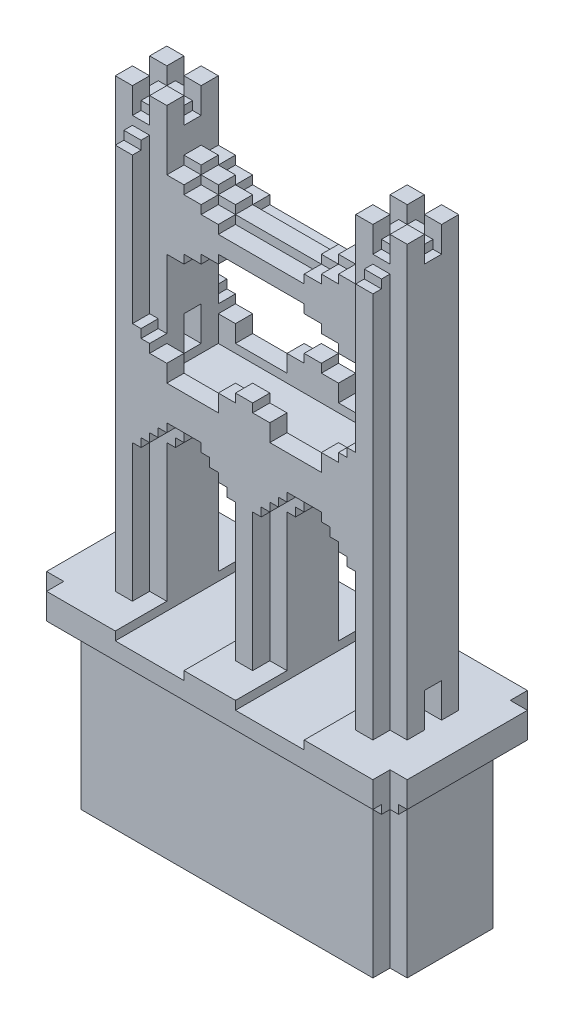
from build123d import *

# Parameters (mm, degrees)
AUFSATZ_LINEAR_AUSTRAGEN1_DEPTH     = 1.5
AUFSATZ_LINEAR_START                = -2.5
AUFSATZ_LINEAR_AUSTRAGEN2_DEPTH     = 5
AUFSATZ_LINEAR_AUSTRAGEN3_DEPTH     = 12
SKIZZE3_W                           = 1
SKIZZE3_H                           = 1
SCHNITT_LINEAR_AUSTRAGEN1_DEPTH     = 15.91643389
SKIZZE6_W                           = 1
SKIZZE6_H                           = 1
AUFSATZ_LINEAR_AUSTRAGEN6_DEPTH     = 12
SKIZZE20_W                          = 5.5
SKIZZE20_H                          = 3
SCHNITT_LINEAR_AUSTRAGEN9_DEPTH     = 0.5
SCHNITT_LINEAR_AUSTRAGEN4_REACH     = 26.749
SKIZZE7_W                           = 1
SKIZZE7_H                           = 2
SKIZZE9_W                           = 2.5
SKIZZE9_H                           = 0.5
SKIZZE9_W_2                         = 1
AUFSATZ_LINEAR_AUSTRAGEN7_DEPTH     = 0.5
AUFSATZ_LINEAR_START_2              = -1.5
AUFSATZ_LINEAR_AUSTRAGEN8_DEPTH     = 3
AUFSATZ_LINEAR_AUSTRAGEN4_OUTLINE_W = 1
AUFSATZ_LINEAR_AUSTRAGEN4_OUTLINE_H = 1
AUFSATZ_LINEAR_AUSTRAGEN4_DEPTH     = 1
AUFSATZ_LINEAR_START_3              = 1
AUFSATZ_LINEAR_AUSTRAGEN5_DEPTH     = 10
AUFSATZ_LINEAR_AUSTRAGEN9_DEPTH     = 1
SCHNITT_LINEAR_AUSTRAGEN5_REACH     = 27.855
SKIZZE8_W                           = 1
SKIZZE8_H                           = 2
SKIZZE16_W                          = 0.5
SKIZZE16_H                          = 0.5
SCHNITT_LINEAR_AUSTRAGEN7_DEPTH     = 1
SKIZZE14_W                          = 1
SKIZZE14_H                          = 1
AUFSATZ_LINEAR_AUSTRAGEN15_DEPTH    = 1
SKIZZE17_W                          = 4
SKIZZE17_H                          = 0.5
SCHNITT_LINEAR_AUSTRAGEN8_DEPTH     = 29.570089254
AUFSATZ_LINEAR_AUSTRAGEN16_REACH    = 29.486
AUFSATZ_LINEAR_AUSTRAGEN17_DEPTH    = 7
SKIZZE21_W                          = 0.5
SKIZZE21_H                          = 1
SCHNITT_LINEAR_AUSTRAGEN10_DEPTH    = 0.5
SCHNITT_LINEAR_AUSTRAGEN11_DEPTH    = 1


# Read off the part's stored shape, not the designer's step: Aufsatz-Linear austragen2, Aufsatz-Linear austragen4, Aufsatz-Linear austragen5
with BuildPart() as part:
    # Skizze1 → Aufsatz-Linear austragen1 (new, symmetric)
    with BuildSketch(Plane.XY):
        Polygon((-3, 9), (-2.5, 9), (-2.5, 8.5), (-2, 8.5), (-2, 8), (-1.5, 8), (-1.5, 0), (0, 0), (0, 12), (-3.5, 12), (-3.5, 9.5), (-3, 9.5), align=None)
    extrude(amount=AUFSATZ_LINEAR_AUSTRAGEN1_DEPTH, both=True)

    # Aufsatz-Linear austragen2 outline → Aufsatz-Linear austragen2 (add)
    with BuildSketch(Plane.XY.offset(AUFSATZ_LINEAR_START)):
        Polygon((-1, 8.5), (-1, 8), (-0.5, 8), (-0.5, 0), (0, 0), (0, 12), (-3.5, 12), (-3.5, 10), (-2.5, 10), (-2.5, 9.5), (-2, 9.5), (-2, 9), (-1.5, 9), (-1.5, 8.5), align=None)
    extrude(amount=AUFSATZ_LINEAR_AUSTRAGEN2_DEPTH)

    # Spiegeln6: part across face


with BuildPart() as part_1:
    add(part.part)
    add(part.part.mirror(Plane(origin=(-3.5, 10.836956522, 0), x_dir=(0, 0, 1), z_dir=(-1, 0, 0))))

    # Skizze2 → Aufsatz-Linear austragen3 (add)
    with BuildSketch(Plane(origin=(0, 12, 0), x_dir=(1, 0, 0), z_dir=(0, 1, 0))):
        Polygon((-7, 2.5), (-7.5, 2.5), (-7.5, 1.5), (-8.5, 1.5), (-8.5, -1.5), (-7.5, -1.5), (-7.5, -2.5), (-7, -2.5), align=None)
    extrude(amount=-AUFSATZ_LINEAR_AUSTRAGEN3_DEPTH)

    # Skizze3 → Schnitt-Linear austragen1 (cut, through all)
    with BuildSketch(Plane(origin=(0, 12, 0), x_dir=(1, 0, 0), z_dir=(0, 1, 0))):
        with Locations((-7, 0)):
            Rectangle(SKIZZE3_W, SKIZZE3_H)
    extrude(amount=-SCHNITT_LINEAR_AUSTRAGEN1_DEPTH, mode=Mode.SUBTRACT)

    # Skizze6 → Aufsatz-Linear austragen6 (add)
    with BuildSketch(Plane(origin=(0, 12, 0), x_dir=(1, 0, 0), z_dir=(0, 1, 0))):
        Polygon((-7.5, 2.5), (-7.5, 1.5), (-8.5, 1.5), (-8.5, -1.5), (-7.5, -1.5), (-7.5, -2.5), (-6.5, -2.5), (-6.5, -1.5), (-5.5, -1.5), (-5.5, 1.5), (-6.5, 1.5), (-6.5, 2.5), align=None)
        with Locations((-7, 0)):
            Rectangle(SKIZZE6_W, SKIZZE6_H, mode=Mode.SUBTRACT)
    extrude(amount=AUFSATZ_LINEAR_AUSTRAGEN6_DEPTH)

    # Skizze20 → Schnitt-Linear austragen9 (cut)
    with BuildSketch(Plane(origin=(0, 12, 0), x_dir=(1, 0, 0), z_dir=(0, 1, 0))):
        with Locations((-2.75, 0)):
            Rectangle(SKIZZE20_W, SKIZZE20_H)
    extrude(amount=-SCHNITT_LINEAR_AUSTRAGEN9_DEPTH, mode=Mode.SUBTRACT)

    # Skizze7 → Schnitt-Linear austragen4 (cut, up to next)
    with BuildSketch(Plane(origin=(-5.5, 0, 0), x_dir=(0, 0, -1), z_dir=(1, 0, 0)), mode=Mode.PRIVATE) as schnitt_linear_austragen4_sk1:
        with Locations((0, 13)):
            Rectangle(SKIZZE7_W, SKIZZE7_H)
    schnitt_linear_austragen4_tool1 = extrude(schnitt_linear_austragen4_sk1.sketch, amount=-SCHNITT_LINEAR_AUSTRAGEN4_REACH, mode=Mode.PRIVATE) & part_1.part
    add(schnitt_linear_austragen4_tool1.solids().sort_by_distance((-5.5, 13, 0))[0], mode=Mode.SUBTRACT)

    # Skizze9 → Aufsatz-Linear austragen7 (add, symmetric)
    with BuildSketch(Plane.XY):
        with Locations((-1.25, 18.75)):
            Rectangle(SKIZZE9_W, SKIZZE9_H)
        Polygon((-3.5, 18.5), (-2.5, 18.5), (-2.5, 19), (0, 19), (0, 19.5), (-5.5, 19.5), (-5.5, 17.5), (-4.5, 17.5), (-4.5, 18), (-3.5, 18), align=None)
        with Locations((-3, 18.25)):
            Rectangle(SKIZZE9_W_2, SKIZZE9_H)
        with Locations((-4, 17.75)):
            Rectangle(SKIZZE9_W_2, SKIZZE9_H)
        with Locations((-5, 17.25)):
            Rectangle(SKIZZE9_W_2, SKIZZE9_H)
        Polygon((-5.5, 19.5), (0, 19.5), (0, 20), (-2.5, 20), (-2.5, 20.5), (-3.5, 20.5), (-3.5, 21), (-4.5, 21), (-4.5, 21.5), (-5.5, 21.5), align=None)
        with Locations((-5, 21.75)):
            Rectangle(SKIZZE9_W_2, SKIZZE9_H)
        with Locations((-4, 21.25)):
            Rectangle(SKIZZE9_W_2, SKIZZE9_H)
        with Locations((-3, 20.75)):
            Rectangle(SKIZZE9_W_2, SKIZZE9_H)
        with Locations((-1.25, 20.25)):
            Rectangle(SKIZZE9_W, SKIZZE9_H)
    extrude(amount=AUFSATZ_LINEAR_AUSTRAGEN7_DEPTH, both=True)

    # Skizze9<3> → Aufsatz-Linear austragen8 (add)
    with BuildSketch(Plane.XY.offset(AUFSATZ_LINEAR_START_2)):
        Polygon((-3.5, 18.5), (-2.5, 18.5), (-2.5, 19), (0, 19), (0, 19.5), (-5.5, 19.5), (-5.5, 17.5), (-4.5, 17.5), (-4.5, 18), (-3.5, 18), align=None)
        Polygon((-5.5, 19.5), (0, 19.5), (0, 20), (-2.5, 20), (-2.5, 20.5), (-3.5, 20.5), (-3.5, 21), (-4.5, 21), (-4.5, 21.5), (-5.5, 21.5), align=None)
    extrude(amount=AUFSATZ_LINEAR_AUSTRAGEN8_DEPTH)

    # Aufsatz-Linear austragen4 outline → Aufsatz-Linear austragen4 (add)
    with BuildSketch(Plane.XZ):
        Polygon((-9.5, -3.5), (-9.5, -4.5), (0, -4.5), (0, 4.5), (-9.5, 4.5), (-9.5, 3.5), (-10.5, 3.5), (-10.5, -3.5), align=None)
        with Locations((-7, 0)):
            Rectangle(AUFSATZ_LINEAR_AUSTRAGEN4_OUTLINE_W, AUFSATZ_LINEAR_AUSTRAGEN4_OUTLINE_H, mode=Mode.SUBTRACT)
    extrude(amount=AUFSATZ_LINEAR_AUSTRAGEN4_DEPTH)

    # Aufsatz-Linear austragen5 outline → Aufsatz-Linear austragen5 (add)
    with BuildSketch(Plane.XZ.offset(AUFSATZ_LINEAR_START_3)):
        Polygon((0, 2.5), (0, 3.5), (-8.5, 3.5), (-8.5, 2.5), (-9.5, 2.5), (-9.5, -2.5), (-8.5, -2.5), (-8.5, -3.5), (0, -3.5), (0, -2.5), (-6.5, -2.5), (-6.5, -0.5), (-7.5, -0.5), (-7.5, 0.5), (-6.5, 0.5), (-6.5, 2.5), align=None)
    extrude(amount=AUFSATZ_LINEAR_AUSTRAGEN5_DEPTH)

    # Skizze10 → Aufsatz-Linear austragen9 (add)
    with BuildSketch(Plane.XY.offset(2.5)):
        Polygon((-6.5, 14), (-6.5, 12), (-4.5, 12), (-4.5, 13), (-5.5, 13), (-5.5, 14), align=None)
        Polygon((-1.5, 13), (-1.5, 12), (0, 12), (0, 13.5), (-0.5, 13.5), (-0.5, 13), align=None)
    aufsatz_linear_austragen9 = extrude(amount=-AUFSATZ_LINEAR_AUSTRAGEN9_DEPTH)

    # Skizze8 → Schnitt-Linear austragen5 (cut, up to next)
    with BuildSketch(Plane.ZY.offset(8.5), mode=Mode.PRIVATE) as schnitt_linear_austragen5_sk1:
        with Locations((0, 1)):
            Rectangle(SKIZZE8_W, SKIZZE8_H)
    schnitt_linear_austragen5_tool1 = extrude(schnitt_linear_austragen5_sk1.sketch, amount=-SCHNITT_LINEAR_AUSTRAGEN5_REACH, mode=Mode.PRIVATE) & part_1.part
    add(schnitt_linear_austragen5_tool1.solids().sort_by_distance((-8.5, 1, 0))[0], mode=Mode.SUBTRACT)

    # Skizze16 → Schnitt-Linear austragen7 (cut)
    with BuildSketch(Plane.XY.offset(2.5)):
        with Locations((-5.75, 13.75)):
            Rectangle(SKIZZE16_W, SKIZZE16_H)
    schnitt_linear_austragen7 = extrude(amount=-SCHNITT_LINEAR_AUSTRAGEN7_DEPTH, mode=Mode.SUBTRACT)

    # Spiegeln8: Aufsatz-Linear austragen9, Schnitt-Linear austragen7 across plane
    add(aufsatz_linear_austragen9.mirror(Plane.XY))
    add(schnitt_linear_austragen7.mirror(Plane.XY), mode=Mode.SUBTRACT)

    # Skizze14 → Aufsatz-Linear austragen15 (add)
    with BuildSketch(Plane(origin=(0, 24, 0), x_dir=(1, 0, 0), z_dir=(0, 1, 0))):
        with Locations((-8, 1)):
            Rectangle(SKIZZE14_W, SKIZZE14_H)
        with Locations((-6, 1)):
            Rectangle(SKIZZE14_W, SKIZZE14_H)
        with Locations((-6, -1)):
            Rectangle(SKIZZE14_W, SKIZZE14_H)
        with Locations((-8, -1)):
            Rectangle(SKIZZE14_W, SKIZZE14_H)
    extrude(amount=AUFSATZ_LINEAR_AUSTRAGEN15_DEPTH)

    # Skizze17 → Schnitt-Linear austragen8 (cut, through all)
    with BuildSketch(Plane.XY.offset(4.5)):
        with Locations((-3.5, -0.25)):
            Rectangle(SKIZZE17_W, SKIZZE17_H)
    extrude(amount=-SCHNITT_LINEAR_AUSTRAGEN8_DEPTH, mode=Mode.SUBTRACT)

    # Aufsatz-Linear austragen16: up to this face of the body (flat: up to its plane)
    aufsatz_linear_austragen16_end = Plane(part_1.part.faces().sort_by_distance((-9.5, -0.5, 4))[0])
    # Skizze18 → Aufsatz-Linear austragen16 (add, up to the picked face)
    with BuildSketch(Plane(origin=(0, 0, 0), x_dir=(0, 0, -1), z_dir=(1, 0, 0)), mode=Mode.PRIVATE) as aufsatz_linear_austragen16_sk1:
        Polygon((-4.5, -1), (-4.5, -1.5), (-4, -1.5), (-4, -2), (-3.5, -2), (-3.5, -1), align=None)
    aufsatz_linear_austragen16_tool1 = split(extrude(aufsatz_linear_austragen16_sk1.sketch, amount=-AUFSATZ_LINEAR_AUSTRAGEN16_REACH, mode=Mode.PRIVATE), bisect_by=aufsatz_linear_austragen16_end, keep=Keep.BOTH, mode=Mode.PRIVATE)
    # Skizze18 → Aufsatz-Linear austragen16 (add, up to the picked face)
    with BuildSketch(Plane(origin=(0, 0, 0), x_dir=(0, 0, -1), z_dir=(1, 0, 0)), mode=Mode.PRIVATE) as aufsatz_linear_austragen16_sk2:
        Polygon((3.5, -1), (4.5, -1), (4.5, -1.5), (4, -1.5), (4, -2), (3.5, -2), align=None)
    aufsatz_linear_austragen16_tool2 = split(extrude(aufsatz_linear_austragen16_sk2.sketch, amount=-AUFSATZ_LINEAR_AUSTRAGEN16_REACH, mode=Mode.PRIVATE), bisect_by=aufsatz_linear_austragen16_end, keep=Keep.BOTH, mode=Mode.PRIVATE)
    add(aufsatz_linear_austragen16_tool1.solids().sort_by(Axis((0, -1.416667, 3.916667), (-1, 0, 0)))[0])
    add(aufsatz_linear_austragen16_tool2.solids().sort_by(Axis((0, -1.416667, -3.916667), (-1, 0, 0)))[0])

    # Skizze19 → Aufsatz-Linear austragen17 (add)
    with BuildSketch(Plane.XY.offset(3.5)):
        Polygon((-10.5, -1), (-10.5, -1.5), (-10, -1.5), (-10, -2), (-9.5, -2), (-8.5, -2), (-8.5, -1), align=None)
    extrude(amount=-AUFSATZ_LINEAR_AUSTRAGEN17_DEPTH)

    # Skizze21 → Schnitt-Linear austragen10 (cut)
    with BuildSketch(Plane(origin=(0, 24, 0), x_dir=(1, 0, 0), z_dir=(0, 1, 0))):
        with Locations((-8.25, 0)):
            Rectangle(SKIZZE21_W, SKIZZE21_H)
        with Locations((-5.75, 0)):
            Rectangle(SKIZZE21_W, SKIZZE21_H)
    extrude(amount=-SCHNITT_LINEAR_AUSTRAGEN10_DEPTH, mode=Mode.SUBTRACT)

    # Skizze22 → Schnitt-Linear austragen11 (cut)
    with BuildSketch(Plane(origin=(-6.5, 0, 0), x_dir=(0, 0, -1), z_dir=(1, 0, 0))):
        Polygon((-2.5, 24), (-2.5, 22.5), (-2, 22.5), (-2, 23), (-1.5, 23), (-1.5, 23.5), (-1, 23.5), (-1, 24), align=None)
        Polygon((1, 24), (2.5, 24), (2.5, 22.5), (2, 22.5), (2, 23), (1.5, 23), (1.5, 23.5), (1, 23.5), align=None)
    extrude(amount=-SCHNITT_LINEAR_AUSTRAGEN11_DEPTH, mode=Mode.SUBTRACT)

    # Spiegeln7: part across face


with BuildPart() as part_2:
    add(part_1.part)
    add(part_1.part.mirror(Plane(origin=(0, 2.760869565, 0), x_dir=(0, 0, 1), z_dir=(1, 0, 0))))


solid = part_2.part
